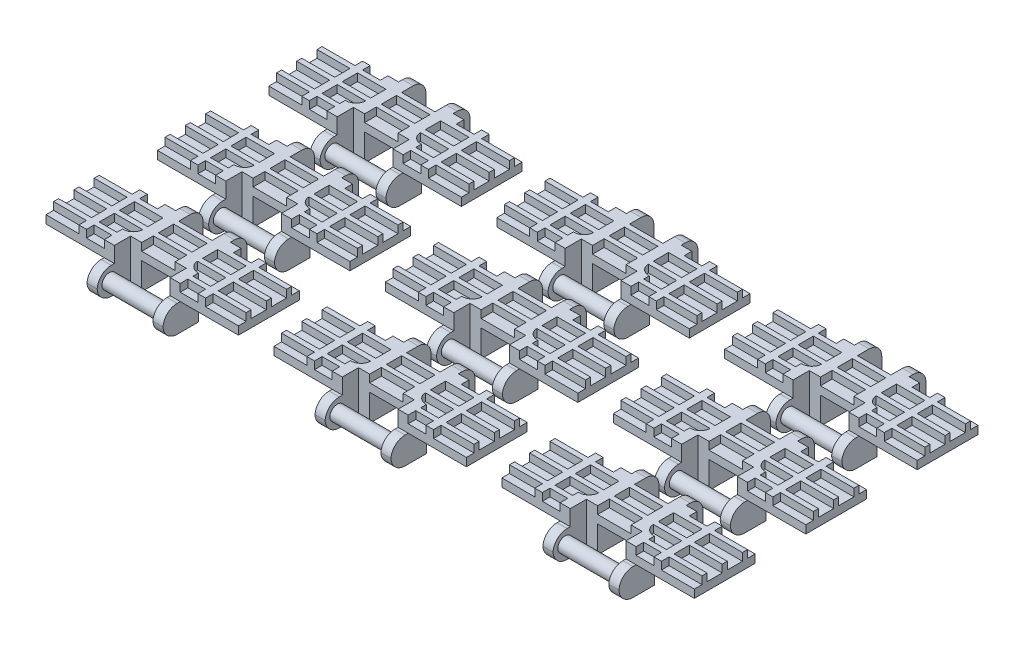
from build123d import *

# Parameters (mm, degrees)
SKETCH_1_W               = 38
SKETCH_1_H               = 12
EXTRUDE_1_DEPTH          = 1.6
EXTRUDE_START            = 1.6
SKETCH_1_3_W             = 38
SKETCH_1_3_H             = 1
SKETCH_1_3_W_2           = 1.5
SKETCH_1_3_H_2           = 12
EXTRUDE_2_DEPTH          = 1.5
EXTRUDE_START_2          = 3.1
EXTRUDE_3_DEPTH          = 8.4
SKETCH_2_4_W             = 2.1
SKETCH_2_4_H             = 1.5
EXTRUDE_5_DEPTH          = 3.1
CUT_EXTRUDE_1_DEPTH      = 22.850629282
FILLET_1_R               = 3
EXTRUDE_4_REACH          = 28.771
SKETCH_3_R               = 1.45
CUT_EXTRUDE_2_DEPTH      = 27.771253239
CUT_EXTRUDE_2_DEPTH_BACK = 27.771253239
SKETCH_3_3_R             = 1.7
SKETCH_3_3_W             = 6.5
SKETCH_3_3_H             = 1.2
SKETCH_3_3_W_2           = 3.4
SKETCH_3_3_H_2           = 3.1
FILLET_2_R               = 2.8
FILLET_3_R               = 2.5
FILLET_4_R               = 1
FILLET_5_R               = 0.3
FILLET_6_R               = 2
PATTERN_LINEAR_1_COUNT   = 3
PATTERN_LINEAR_1_PITCH   = 22
PATTERN_LINEAR_2_COUNT   = 3
PATTERN_LINEAR_2_PITCH   = 45


with BuildPart() as part:
    # 草图1 → 凸台-拉伸1 (new body)
    with BuildSketch(Plane(origin=(0, 0, 0), x_dir=(1, 0, 0), z_dir=(0, 1, 0))):
        Rectangle(SKETCH_1_W, SKETCH_1_H)
    extrude(amount=EXTRUDE_1_DEPTH)

    # 草图1<3> → 凸台-拉伸2 (add)
    with BuildSketch(Plane(origin=(0, 0, 0), x_dir=(1, 0, 0), z_dir=(0, 1, 0)).offset(EXTRUDE_START)):
        with Locations((0, 4)):
            Rectangle(SKETCH_1_3_W, SKETCH_1_3_H)
        Rectangle(SKETCH_1_3_W, SKETCH_1_3_H)
        with Locations((0, -4)):
            Rectangle(SKETCH_1_3_W, SKETCH_1_3_H)
        with Locations((-11.75, 0)):
            Rectangle(SKETCH_1_3_W_2, SKETCH_1_3_H_2)
        with Locations((11.75, 0)):
            Rectangle(SKETCH_1_3_W_2, SKETCH_1_3_H_2)
    extrude(amount=EXTRUDE_2_DEPTH)

    # 草图2 → 凸台-拉伸3 (add)
    with BuildSketch(Plane(origin=(0, 0, 0), x_dir=(1, 0, 0), z_dir=(0, 1, 0)).offset(EXTRUDE_START_2)):
        Polygon((-3.3, 9.3), (-5.4, 9.3), (-5.4, -2.4), (-7.5, -2.4), (-7.5, -9.4), (-5.5, -9.4), (-5.5, -2.8), (-3.3, -2.8), align=None)
        Polygon((5.4, 9.3), (3.3, 9.3), (3.3, -2.8), (5.5, -2.8), (5.5, -9.4), (7.5, -9.4), (7.5, -2.4), (5.4, -2.4), align=None)
    extrude(amount=-EXTRUDE_3_DEPTH)

    # 草图2<4> → 凸台-拉伸5 (add)
    with BuildSketch(Plane(origin=(0, 0, 0), x_dir=(1, 0, 0), z_dir=(0, 1, 0))):
        with Locations((-6.45, 5.25)):
            Rectangle(SKETCH_2_4_W, SKETCH_2_4_H)
        with Locations((6.45, 5.25)):
            Rectangle(SKETCH_2_4_W, SKETCH_2_4_H)
    extrude(amount=EXTRUDE_5_DEPTH)

    # 草图2<3> → 切除-拉伸1 (cut, through all)
    with BuildSketch(Plane(origin=(0, 0, 0), x_dir=(1, 0, 0), z_dir=(0, 1, 0))):
        Polygon((0, -9.4), (0, -2.8), (-3.3, -2.8), (-5.4, -2.8), (-5.5, -2.8), (-5.5, -9.4), align=None)
        Polygon((3.3, -2.8), (0, -2.8), (0, -9.4), (5.5, -9.4), (5.5, -2.8), (5.4, -2.8), align=None)
    extrude(amount=CUT_EXTRUDE_1_DEPTH, mode=Mode.SUBTRACT)

    # 圆角1
    # the kernel refuses this fillet: 3 mm, written as the material it adds along each edge
    with BuildSketch(Plane(origin=(5.4, 7.154544011, 2.4), x_dir=(1, 0, 0), z_dir=(0, -1, 0))) as fillet_1_piece_1_section:
        with BuildLine():
            CenterArc((3, -2.861817604), FILLET_1_R, 107.457603124, 72.542396876)
            Line((0, -2.861817604), (0, 0))
            Line((0, 0), (2.1, 0))
        make_face()
    fillet_1_piece_1 = extrude(amount=12.454544011, mode=Mode.PRIVATE)
    fillet_1_piece_1 = split(fillet_1_piece_1, bisect_by=Plane(origin=(6.297598678, 1.6, 1.686657362), z_dir=(0, -1, 0)), keep=Keep.TOP, mode=Mode.PRIVATE)
    add(fillet_1_piece_1)
    with BuildSketch(Plane(origin=(-5.4, 0, 2.4), x_dir=(0, 0, -1), z_dir=(0, -1, 0))) as fillet_1_piece_2:
        with BuildLine():
            CenterArc((2.861817604, -3), FILLET_1_R, 90, 72.542396876)
            Line((0, -2.1), (0, 0))
            Line((0, 0), (2.861817604, 0))
        make_face()
    extrude(amount=5.3)

    # 草图3 → 凸台-拉伸4 (add, up to next)
    with BuildSketch(Plane(origin=(-5.5, 0, 0), x_dir=(0, 0, -1), z_dir=(1, 0, 0)), mode=Mode.PRIVATE) as extrude_4_sk1:
        with Locations((-7, -2.5)):
            Circle(SKETCH_3_R)
    extrude_4_tool1 = extrude(extrude_4_sk1.sketch, amount=EXTRUDE_4_REACH, mode=Mode.PRIVATE) - part.part
    add(extrude_4_tool1.solids().sort_by_distance((-5.5, -2.5, 7))[0])

    # 草图3<3> → 切除-拉伸2 (cut, two sides: drawn at the far end of the back side and taken through both)
    with BuildSketch(Plane(origin=(-5.5, 0, 0), x_dir=(0, 0, -1), z_dir=(1, 0, 0)).offset(-CUT_EXTRUDE_2_DEPTH_BACK)):
        with Locations((5.58, -2.5)):
            Circle(SKETCH_3_3_R)
        with Locations((6.05, -4.7)):
            Rectangle(SKETCH_3_3_W, SKETCH_3_3_H)
        with Locations((-7.7, 1.55)):
            Rectangle(SKETCH_3_3_W_2, SKETCH_3_3_H_2)
    extrude(amount=CUT_EXTRUDE_2_DEPTH + CUT_EXTRUDE_2_DEPTH_BACK, mode=Mode.SUBTRACT)

    # 圆角2
    # the kernel refuses this fillet: 2.8 mm, written as the material it takes off along each edge
    with BuildSketch(Plane(origin=(-1.5, 0, 9.4), x_dir=(0, 0, -1), z_dir=(1, 0, 0)), Plane(origin=(-14.5, 0, 9.4), x_dir=(0, 0, -1), z_dir=(1, 0, 0))) as fillet_2_piece_1:
        with BuildLine():
            CenterArc((FILLET_2_R, -FILLET_2_R), FILLET_2_R, 90, 90)
            Line((0, -FILLET_2_R), (0, 0))
            Line((0, 0), (FILLET_2_R, 0))
        make_face()
    extrude(amount=16, mode=Mode.SUBTRACT)
    with BuildSketch(Plane(origin=(-1.5, -5.3, 9.4), x_dir=(0, 0, -1), z_dir=(1, 0, 0)), Plane(origin=(-14.5, -5.3, 9.4), x_dir=(0, 0, -1), z_dir=(1, 0, 0))) as fillet_2_piece_2:
        with BuildLine():
            CenterArc((FILLET_2_R, FILLET_2_R), FILLET_2_R, 180, 90)
            Line((0, FILLET_2_R), (0, 0))
            Line((0, 0), (FILLET_2_R, 0))
        make_face()
    extrude(amount=16, mode=Mode.SUBTRACT)

    # 圆角3
    fillet_3_edges = [part.edges().sort_by_distance(p)[0] for p in [
        (-4.35, 3.1, -9.3),
        (4.35, 3.1, -9.3),
    ]]
    fillet(fillet_3_edges, radius=FILLET_3_R)

    # 圆角4
    fillet_4_edges = [part.edges().sort_by_distance(p)[0] for p in [
        (-4.35, -4.1, -9.3),
        (4.35, -4.1, -9.3),
    ]]
    fillet(fillet_4_edges, radius=FILLET_4_R)

    # 圆角5
    fillet_5_edges = [part.edges().sort_by_distance(p)[0] for p in [
        (-4.35, -4.1, -5.005543735),
        (4.35, -4.1, -5.005543735),
        (-4.35, -4.1, -6.154456265),
        (4.35, -4.1, -6.154456265),
    ]]
    fillet(fillet_5_edges, radius=FILLET_5_R)

    # 圆角6
    # the kernel refuses this fillet: 2 mm, written as the material it adds along each edge
    with BuildSketch(Plane(origin=(5.4, 3.1, 2.4), x_dir=(0, 0, -1), z_dir=(0, -1, 0))) as fillet_6_piece_1:
        with BuildLine():
            CenterArc((2, 1.997498436), FILLET_6_R, 180, 87.134016017)
            Line((0, 1.997498436), (-0.04, 1.997498436))
            Line((-0.04, 1.997498436), (-0.04, 0))
            Line((-0.04, 0), (0, -0.04))
            ThreePointArc((0, -0.04), (0.95, -0.04), (1.898, -0.039949969))
            Line((1.898, -0.039949969), (1.9, 0))
        make_face()
    extrude(amount=6.493746089)
    with BuildSketch(Plane(origin=(-5.4, 3.1, 2.4), x_dir=(-1, 0, 0), z_dir=(0, -1, 0))) as fillet_6_piece_2:
        with BuildLine():
            CenterArc((1.997498436, 2), FILLET_6_R, 182.865983983, 87.134016017)
            Line((0, 1.9), (-0.039949969, 1.898))
            ThreePointArc((-0.039949969, 1.898), (-0.04, 0.95), (-0.04, 0))
            Line((-0.04, 0), (0, -0.04))
            Line((0, -0.04), (1.997498436, -0.04))
            Line((1.997498436, -0.04), (1.997498436, 0))
        make_face()
    extrude(amount=6.493746089)


with BuildPart() as pattern_linear_1_1:
    # 阵列(线性)1: pattern copy
    add(part.part.moved(Location(Vector(0, 0, 1) * (1 * PATTERN_LINEAR_1_PITCH))))


with BuildPart() as pattern_linear_1_2:
    # 阵列(线性)1: pattern copy
    add(part.part.moved(Location(Vector(0, 0, 1) * (2 * PATTERN_LINEAR_1_PITCH))))


with BuildPart() as pattern_linear_2_1:
    # 阵列(线性)2: pattern copy
    add(part.part.moved(Location(Vector(1, 0, 0) * (1 * PATTERN_LINEAR_2_PITCH))))


with BuildPart() as pattern_linear_2_2:
    # 阵列(线性)2: pattern copy
    add(part.part.moved(Location(Vector(1, 0, 0) * (2 * PATTERN_LINEAR_2_PITCH))))


with BuildPart() as pattern_linear_2_3:
    # 阵列(线性)2: pattern copy
    add(pattern_linear_1_1.part.moved(Location(Vector(1, 0, 0) * (1 * PATTERN_LINEAR_2_PITCH))))


with BuildPart() as pattern_linear_2_4:
    # 阵列(线性)2: pattern copy
    add(pattern_linear_1_1.part.moved(Location(Vector(1, 0, 0) * (2 * PATTERN_LINEAR_2_PITCH))))


with BuildPart() as pattern_linear_2_5:
    # 阵列(线性)2: pattern copy
    add(pattern_linear_1_2.part.moved(Location(Vector(1, 0, 0) * (1 * PATTERN_LINEAR_2_PITCH))))


with BuildPart() as pattern_linear_2_6:
    # 阵列(线性)2: pattern copy
    add(pattern_linear_1_2.part.moved(Location(Vector(1, 0, 0) * (2 * PATTERN_LINEAR_2_PITCH))))


solid = Compound([part.part, pattern_linear_1_1.part, pattern_linear_1_2.part, pattern_linear_2_1.part, pattern_linear_2_2.part, pattern_linear_2_3.part, pattern_linear_2_4.part, pattern_linear_2_5.part, pattern_linear_2_6.part])
